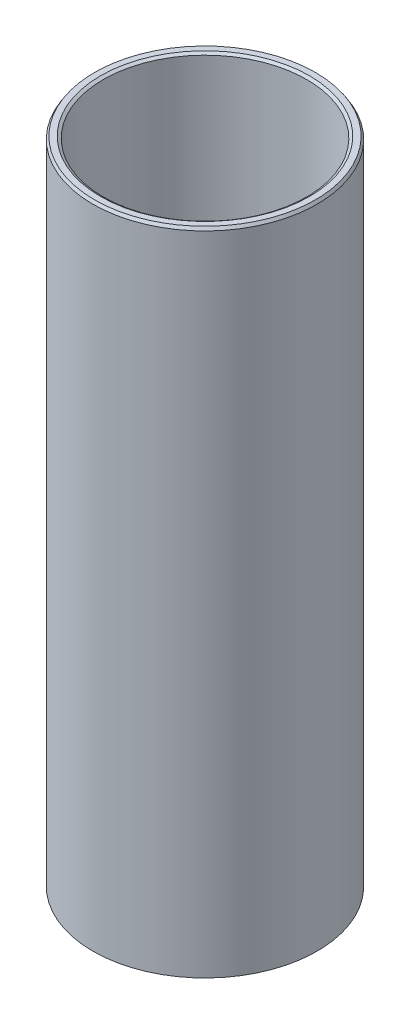
from build123d import *
from OCP.BRepFilletAPI import BRepFilletAPI_MakeChamfer

# Parameters (mm, degrees)
SKETCH1_R           = 55
BOSS_EXTRUDE1_DEPTH = 319.319546374
SKETCH2_R           = 49.855486096
CUT_EXTRUDE1_DEPTH  = 329.656313946
CHAMFER1_SIZE       = 1.37468506
CHAMFER1_SIZE2      = 0.891832324


with BuildPart() as part:
    # Sketch1 → Boss-Extrude1 (new body)
    with BuildSketch(Plane(origin=(0, 0, 0), x_dir=(1, 0, 0), z_dir=(0, 1, 0))):
        Circle(SKETCH1_R)
    extrude(amount=BOSS_EXTRUDE1_DEPTH)

    # Sketch2 → Cut-Extrude1 (cut, through all)
    with BuildSketch(Plane(origin=(0, 0, 0), x_dir=(1, 0, 0), z_dir=(0, 1, 0))):
        Circle(SKETCH2_R)
    extrude(amount=CUT_EXTRUDE1_DEPTH, mode=Mode.SUBTRACT)

    # Chamfer1: one chamfer whose edges measure the first distance from different faces: ONE call of the kernel's chamfer builder (chamfer() names one face for all edges)
    chamfer1_edges_1 = [part.edges().sort_by_distance(p)[0] for p in [
        (-49.855486096, 319.319546374, 0),
    ]]
    chamfer1_side_1 = [part.faces().sort_by_distance(p)[0] for p in [
        (-53.444365081, 319.319546374, 0),
    ]]
    chamfer1_edges_2 = [part.edges().sort_by_distance(p)[0] for p in [
        (-49.855486096, 0, 0),
    ]]
    chamfer1_side_2 = [part.faces().sort_by_distance(p)[0] for p in [
        (-49.855486096, 159.659773187, 0),
    ]]
    chamfer1_edges_3 = [part.edges().sort_by_distance(p)[0] for p in [
        (-55, 0, 0),
    ]]
    chamfer1_side_3 = [part.faces().sort_by_distance(p)[0] for p in [
        (-53.444365081, 0, 0),
    ]]
    chamfer1_edges_4 = [part.edges().sort_by_distance(p)[0] for p in [
        (-55, 319.319546374, 0),
    ]]
    chamfer1_side_4 = [part.faces().sort_by_distance(p)[0] for p in [
        (-55, 159.659773187, 0),
    ]]
    chamfer1 = BRepFilletAPI_MakeChamfer(part.part.solid().wrapped)
    for e in chamfer1_edges_1:
        chamfer1.Add(CHAMFER1_SIZE, CHAMFER1_SIZE2, e.wrapped, chamfer1_side_1[0].wrapped)  # the first distance lies on this face
    for e in chamfer1_edges_2:
        chamfer1.Add(CHAMFER1_SIZE, CHAMFER1_SIZE2, e.wrapped, chamfer1_side_2[0].wrapped)  # the first distance lies on this face
    for e in chamfer1_edges_3:
        chamfer1.Add(CHAMFER1_SIZE, CHAMFER1_SIZE2, e.wrapped, chamfer1_side_3[0].wrapped)  # the first distance lies on this face
    for e in chamfer1_edges_4:
        chamfer1.Add(CHAMFER1_SIZE, CHAMFER1_SIZE2, e.wrapped, chamfer1_side_4[0].wrapped)  # the first distance lies on this face
    add(Compound.cast(chamfer1.Shape()), mode=Mode.REPLACE)


solid = part.part
